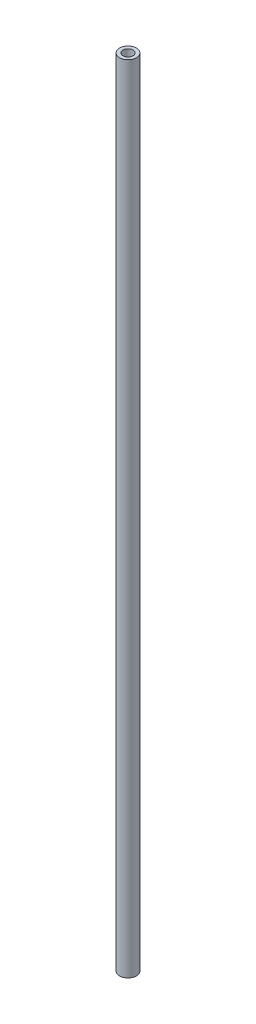
from build123d import *

# Parameters (mm, degrees)
SKETCH1_R           = 1.5875
SKETCH1_R_2         = 0.9525
BOSS_EXTRUDE1_DEPTH = 75


with BuildPart() as part:
    # Sketch1 → Boss-Extrude1 (new, symmetric)
    with BuildSketch(Plane(origin=(0, 0, 0), x_dir=(1, 0, 0), z_dir=(0, 1, 0))):
        Circle(SKETCH1_R)
        Circle(SKETCH1_R_2, mode=Mode.SUBTRACT)
    extrude(amount=BOSS_EXTRUDE1_DEPTH, both=True)


solid = part.part
